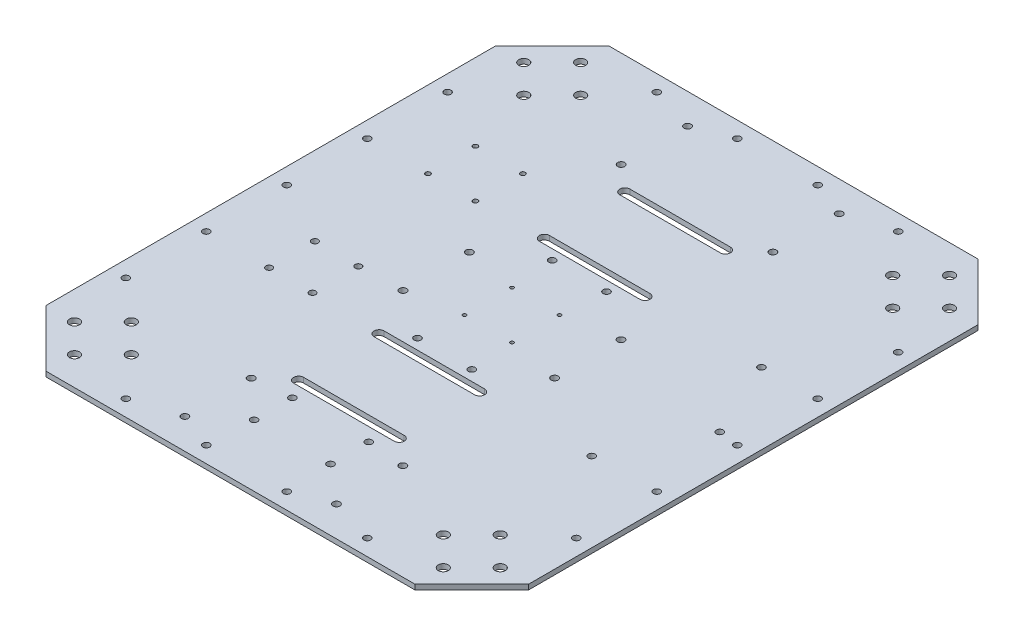
from build123d import *

# Parameters (mm, degrees)
SKETCH1_R           = 2.2225
BOSS_EXTRUDE1_DEPTH = 3.175
SKETCH2_R           = 2.159
CUT_EXTRUDE1_DEPTH  = 297.247830215
CUT_EXTRUDE2_DEPTH  = 297.247830215
SKETCH7_R           = 1.524
CUT_EXTRUDE3_DEPTH  = 297.247830215
SKETCH10_R          = 2.159
CUT_EXTRUDE6_DEPTH  = 297.247830215
SKETCH9_R           = 2.032
CUT_EXTRUDE5_DEPTH  = 297.247830215
SKETCH13_R          = 1.1
CUT_EXTRUDE8_DEPTH  = 297.247830215
SKETCH14_R          = 3.175
CUT_EXTRUDE9_DEPTH  = 297.247830215
SKETCH15_R          = 2.159
CUT_EXTRUDE10_DEPTH = 297.247830215
SKETCH16_R          = 2.159
CUT_EXTRUDE11_DEPTH = 297.247830215


with BuildPart() as part:
    # Sketch1 → Boss-Extrude1 (new body)
    with BuildSketch(Plane(origin=(0, 0, 0), x_dir=(1, 0, 0), z_dir=(0, 1, 0))):
        Polygon((-85.365028143, 123.058976948), (-121.286052627, 87.137952464), (-121.286052627, -196.619998567), (-85.365028143, -232.541023052), (147.592922888, -232.541023052), (183.513947373, -196.619998567), (183.513947373, 87.137952464), (147.592922888, 123.058976948), align=None)
        with Locations((-16.765052627, -213.491023052)):
            Circle(SKETCH1_R, mode=Mode.SUBTRACT)
        with Locations((-16.765052627, -171.581023052)):
            Circle(SKETCH1_R, mode=Mode.SUBTRACT)
        with Locations((-16.765052627, -75.696023052)):
            Circle(SKETCH1_R, mode=Mode.SUBTRACT)
        with Locations((78.992947373, -213.491023052)):
            Circle(SKETCH1_R, mode=Mode.SUBTRACT)
        with Locations((78.992947373, -171.581023052)):
            Circle(SKETCH1_R, mode=Mode.SUBTRACT)
        with Locations((78.992947373, -75.696023052)):
            Circle(SKETCH1_R, mode=Mode.SUBTRACT)
        with Locations((-16.765052627, -33.786023052)):
            Circle(SKETCH1_R, mode=Mode.SUBTRACT)
        with Locations((-16.765052627, 62.098976948)):
            Circle(SKETCH1_R, mode=Mode.SUBTRACT)
        with Locations((-16.765052627, 104.008976948)):
            Circle(SKETCH1_R, mode=Mode.SUBTRACT)
        with Locations((78.992947373, -33.786023052)):
            Circle(SKETCH1_R, mode=Mode.SUBTRACT)
        with Locations((78.992947373, 62.098976948)):
            Circle(SKETCH1_R, mode=Mode.SUBTRACT)
        with Locations((78.992947373, 104.008976948)):
            Circle(SKETCH1_R, mode=Mode.SUBTRACT)
    extrude(amount=BOSS_EXTRUDE1_DEPTH)

    # Sketch2 → Cut-Extrude1 (cut, through all)
    with BuildSketch(Plane(origin=(0, 3.175, 0), x_dir=(1, 0, 0), z_dir=(0, 1, 0))):
        with Locations((13.841947373, -12.069023052)):
            Circle(SKETCH2_R)
        with Locations((48.131947373, -12.069023052)):
            Circle(SKETCH2_R)
        with Locations((13.841947373, -97.159023052)):
            Circle(SKETCH2_R)
        with Locations((48.131947373, -97.159023052)):
            Circle(SKETCH2_R)
    extrude(amount=-CUT_EXTRUDE1_DEPTH, mode=Mode.SUBTRACT)

    # Sketch4 → Cut-Extrude2 (cut, through all)
    with BuildSketch(Plane(origin=(0, 3.175, 0), x_dir=(1, 0, 0), z_dir=(0, 1, 0))):
        with BuildLine():
            Line((-0.636052627, 51.430976948), (62.863947373, 51.430976948))
            ThreePointArc((62.863947373, 51.430976948), (66.038947373, 48.255976948), (62.863947373, 45.080976948))
            Line((62.863947373, 45.080976948), (-0.636052627, 45.080976948))
            ThreePointArc((-0.636052627, 45.080976948), (-3.811052627, 48.255976948), (-0.636052627, 51.430976948))
        make_face()
        with BuildLine():
            Line((-0.636052627, 0.630976948), (62.863947373, 0.630976948))
            ThreePointArc((62.863947373, 0.630976948), (66.038947373, -2.544023052), (62.863947373, -5.719023052))
            Line((62.863947373, -5.719023052), (-0.636052627, -5.719023052))
            ThreePointArc((-0.636052627, -5.719023052), (-3.811052627, -2.544023052), (-0.636052627, 0.630976948))
        make_face()
        with BuildLine():
            Line((-0.636052627, -110.113023052), (62.863947373, -110.113023052))
            ThreePointArc((62.863947373, -110.113023052), (66.038947373, -106.938023052), (62.863947373, -103.763023052))
            Line((62.863947373, -103.763023052), (-0.636052627, -103.763023052))
            ThreePointArc((-0.636052627, -103.763023052), (-3.811052627, -106.938023052), (-0.636052627, -110.113023052))
        make_face()
        with BuildLine():
            Line((-0.636052627, -160.913023052), (62.863947373, -160.913023052))
            ThreePointArc((62.863947373, -160.913023052), (66.038947373, -157.738023052), (62.863947373, -154.563023052))
            Line((62.863947373, -154.563023052), (-0.636052627, -154.563023052))
            ThreePointArc((-0.636052627, -154.563023052), (-3.811052627, -157.738023052), (-0.636052627, -160.913023052))
        make_face()
    extrude(amount=-CUT_EXTRUDE2_DEPTH, mode=Mode.SUBTRACT)

    # Sketch7 → Cut-Extrude3 (cut, through all)
    with BuildSketch(Plane(origin=(0, 3.175, 0), x_dir=(1, 0, 0), z_dir=(0, 1, 0))):
        with Locations((-42.800052627, 26.030976948)):
            Circle(SKETCH7_R)
        with Locations((-42.800052627, -3.941023052)):
            Circle(SKETCH7_R)
        with Locations((-72.772052627, -3.941023052)):
            Circle(SKETCH7_R)
        with Locations((-72.772052627, 26.030976948)):
            Circle(SKETCH7_R)
    extrude(amount=-CUT_EXTRUDE3_DEPTH, mode=Mode.SUBTRACT)

    # Sketch10 → Cut-Extrude6 (cut, through all)
    with BuildSketch(Plane.XZ):
        with Locations((6.983947373, 193.475823052)):
            Circle(SKETCH10_R)
        with Locations((55.243947373, 193.475823052)):
            Circle(SKETCH10_R)
        with Locations((6.983947373, 169.345823052)):
            Circle(SKETCH10_R)
        with Locations((55.243947373, 169.345823052)):
            Circle(SKETCH10_R)
    extrude(amount=-CUT_EXTRUDE6_DEPTH, mode=Mode.SUBTRACT)

    # Sketch9 → Cut-Extrude5 (cut, through all)
    with BuildSketch(Plane(origin=(0, 0, 0), x_dir=(-1, 0, 0), z_dir=(0, -1, 0))):
        with Locations((71.502052627, -105.541023052)):
            Circle(SKETCH9_R)
        with Locations((44.070052627, -105.541023052)):
            Circle(SKETCH9_R)
        with Locations((71.502052627, -76.585023052)):
            Circle(SKETCH9_R)
        with Locations((44.070052627, -76.585023052)):
            Circle(SKETCH9_R)
    extrude(amount=-CUT_EXTRUDE5_DEPTH, mode=Mode.SUBTRACT)

    # Sketch13 → Cut-Extrude8 (cut, through all)
    with BuildSketch(Plane.XZ):
        with Locations((16.113947373, 69.741023052)):
            Circle(SKETCH13_R)
        with Locations((16.113947373, 39.741023052)):
            Circle(SKETCH13_R)
        with Locations((46.113947373, 39.741023052)):
            Circle(SKETCH13_R)
        with Locations((46.113947373, 69.741023052)):
            Circle(SKETCH13_R)
    extrude(amount=-CUT_EXTRUDE8_DEPTH, mode=Mode.SUBTRACT)

    # Sketch14 → Cut-Extrude9 (cut, through all)
    with BuildSketch(Plane.XZ):
        with Locations((-103.325540385, 196.619998567)):
            Circle(SKETCH14_R)
        with Locations((-85.365028143, 214.580510809)):
            Circle(SKETCH14_R)
        with Locations((-85.365028143, 178.659486325)):
            Circle(SKETCH14_R)
        with Locations((-67.404515901, 196.619998567)):
            Circle(SKETCH14_R)
        with Locations((129.632410646, 196.619998567)):
            Circle(SKETCH14_R)
        with Locations((147.592922888, 178.659486325)):
            Circle(SKETCH14_R)
        with Locations((165.55343513, 196.619998567)):
            Circle(SKETCH14_R)
        with Locations((147.592922888, 214.580510809)):
            Circle(SKETCH14_R)
        with Locations((-85.365028143, -105.098464706)):
            Circle(SKETCH14_R)
        with Locations((-103.325540385, -87.137952464)):
            Circle(SKETCH14_R)
        with Locations((-85.365028143, -69.177440222)):
            Circle(SKETCH14_R)
        with Locations((-67.404515901, -87.137952464)):
            Circle(SKETCH14_R)
        with Locations((165.55343513, -87.137952464)):
            Circle(SKETCH14_R)
        with Locations((147.592922888, -69.177440222)):
            Circle(SKETCH14_R)
        with Locations((147.592922888, -105.098464706)):
            Circle(SKETCH14_R)
        with Locations((129.632410646, -87.137952464)):
            Circle(SKETCH14_R)
    extrude(amount=-CUT_EXTRUDE9_DEPTH, mode=Mode.SUBTRACT)

    # Sketch15 → Cut-Extrude10 (cut, through all)
    with BuildSketch(Plane.XZ):
        with Locations((5.713947373, 222.381023052)):
            Circle(SKETCH15_R)
        with Locations((-45.086052627, 222.381023052)):
            Circle(SKETCH15_R)
        with Locations((-111.126052627, 54.741023052)):
            Circle(SKETCH15_R)
        with Locations((-111.126052627, 105.541023052)):
            Circle(SKETCH15_R)
        with Locations((-111.126052627, 156.341023052)):
            Circle(SKETCH15_R)
        with Locations((173.353947373, 156.341023052)):
            Circle(SKETCH15_R)
        with Locations((173.353947373, 105.541023052)):
            Circle(SKETCH15_R)
        with Locations((173.353947373, 54.741023052)):
            Circle(SKETCH15_R)
        with Locations((107.313947373, 222.381023052)):
            Circle(SKETCH15_R)
        with Locations((56.513947373, 222.381023052)):
            Circle(SKETCH15_R)
        with Locations((56.513947373, -112.898976948)):
            Circle(SKETCH15_R)
        with Locations((107.313947373, -112.898976948)):
            Circle(SKETCH15_R)
        with Locations((173.353947373, 3.941023052)):
            Circle(SKETCH15_R)
        with Locations((173.353947373, -46.858976948)):
            Circle(SKETCH15_R)
        with Locations((-111.126052627, -46.858976948)):
            Circle(SKETCH15_R)
        with Locations((-111.126052627, 3.941023052)):
            Circle(SKETCH15_R)
        with Locations((-45.086052627, -112.898976948)):
            Circle(SKETCH15_R)
        with Locations((5.713947373, -112.898976948)):
            Circle(SKETCH15_R)
    extrude(amount=-CUT_EXTRUDE10_DEPTH, mode=Mode.SUBTRACT)

    # Sketch16 → Cut-Extrude11 (cut, through all)
    with BuildSketch(Plane(origin=(0, 0, 0), x_dir=(-1, 0, 0), z_dir=(0, -1, 0))):
        with Locations((-133.333707373, -106.679409794)):
            Circle(SKETCH16_R)
        with Locations((-138.413707373, -4.529409794)):
            Circle(SKETCH16_R)
        with Locations((-160.653947373, -53.029409794)):
            Circle(SKETCH16_R)
    extrude(amount=-CUT_EXTRUDE11_DEPTH, mode=Mode.SUBTRACT)


solid = part.part
